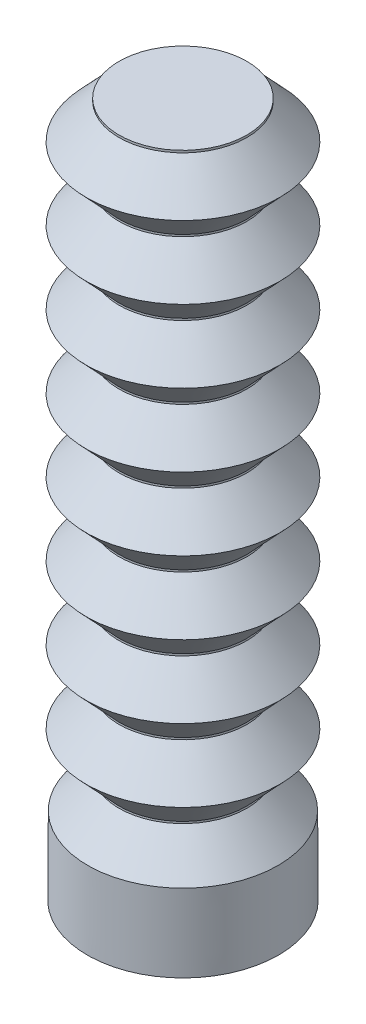
from build123d import *


# Read off the part's stored shape, not the designer's step: Thicken1
with BuildPart() as part:
    # Thicken1 outline → Thicken1 (revolve)
    with BuildSketch(Plane(origin=(-5.431630681, 0, 0), x_dir=(1, 0, 0), z_dir=(0, 0, 1))):
        Polygon((0, -0.954433192), (0, -1.754433192), (4.941383818, -1.754433192), (4.918558927, 2.245501685), (3.3, 3.988409531), (3.3, 4.088409531), (5, 5.913409531), (3.3, 7.738409531), (3.3, 7.838409531), (5, 9.663409531), (3.3, 11.488409531), (3.3, 11.588409531), (5, 13.413409531), (3.3, 15.238409531), (3.3, 15.338409531), (5, 17.163409531), (3.3, 18.988409531), (3.3, 19.088409531), (5, 20.913409531), (3.3, 22.738409531), (3.3, 22.838409531), (5, 24.663409531), (3.3, 26.488409531), (3.3, 26.588409531), (5, 28.413409531), (3.3, 30.238409531), (3.3, 30.338409531), (5, 32.163409531), (3.3, 33.988409531), (3.3, 34.102954004), (0, 34.102954004), (0, 33.302954004), (2.845194483, 33.302954004), (3.906687965, 32.163409531), (2.5, 30.653288628), (2.5, 29.923530434), (3.906687965, 28.413409531), (2.5, 26.903288628), (2.5, 26.173530434), (3.906687965, 24.663409531), (2.5, 23.153288628), (2.5, 22.423530434), (3.906687965, 20.913409531), (2.5, 19.403288628), (2.5, 18.673530434), (3.906687965, 17.163409531), (2.5, 15.653288628), (2.5, 14.923530434), (3.906687965, 13.413409531), (2.5, 11.903288628), (2.5, 11.173530434), (3.906687965, 9.663409531), (2.5, 8.153288628), (2.5, 7.423530434), (3.906687965, 5.913409531), (2.5, 4.403288628), (2.5, 3.674236782), (4.120349674, 1.929400611), (4.136805741, -0.954433192), align=None)
    revolve(axis=Axis((-5.431630681, 0, 0), (0, 1, 0)))


solid = part.part
